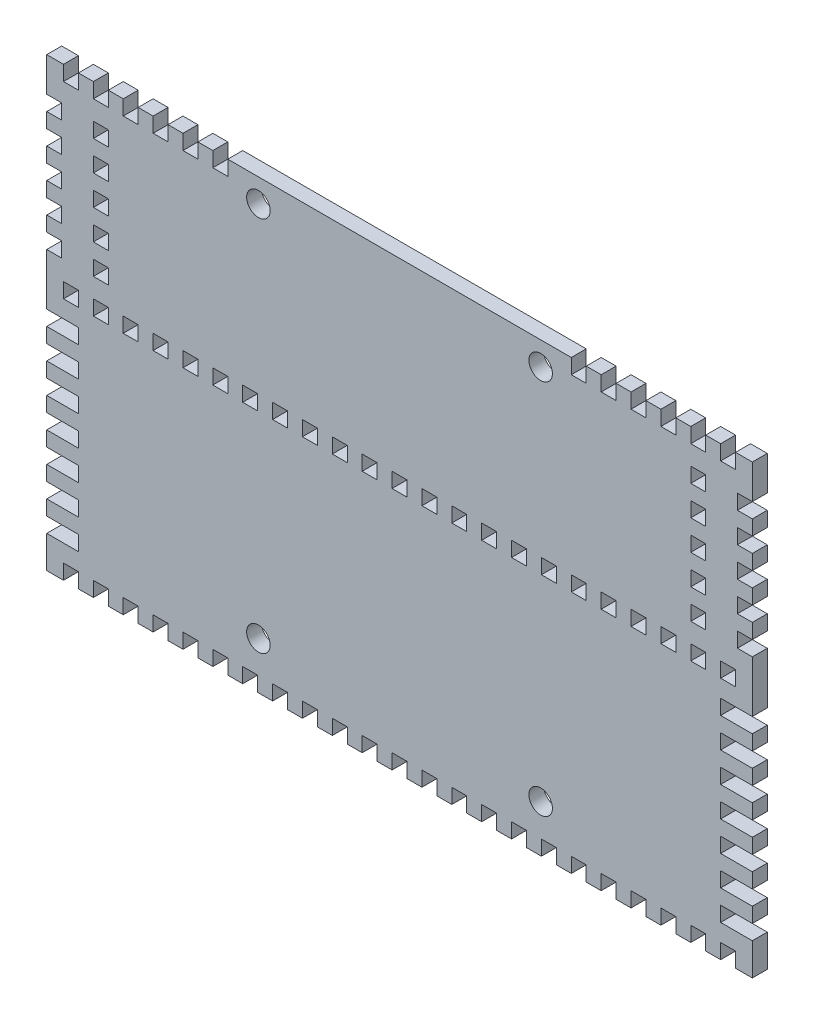
from build123d import *

# Parameters (mm, degrees)
SKETCH1_W                = 150
SKETCH1_H                = 55
BOSS_EXTRUDE1_DEPTH      = 3.175
CUT_EXTRUDE1_REACH       = 81.946
SKETCH2_W                = 3.175
SKETCH2_H                = 6.35
LPATTERN1_COUNT          = 12
LPATTERN1_PITCH          = 6.35
LPATTERN1_COL_COUNT      = 12
LPATTERN1_COL_PITCH      = 6.35
MIRROR1_COPY_1_REACH     = 81.946
MIRROR1_COPY_1_SKETCH_W  = 3.175
MIRROR1_COPY_1_SKETCH_H  = 6.35
MIRROR1_COPY_2_REACH     = 81.946
MIRROR1_COPY_2_SKETCH_W  = 3.175
MIRROR1_COPY_2_SKETCH_H  = 6.35
MIRROR1_COPY_3_REACH     = 81.946
MIRROR1_COPY_3_SKETCH_W  = 3.175
MIRROR1_COPY_3_SKETCH_H  = 6.35
MIRROR1_COPY_4_REACH     = 81.946
MIRROR1_COPY_4_SKETCH_W  = 3.175
MIRROR1_COPY_4_SKETCH_H  = 6.35
MIRROR1_COPY_5_REACH     = 81.946
MIRROR1_COPY_5_SKETCH_W  = 3.175
MIRROR1_COPY_5_SKETCH_H  = 6.35
MIRROR1_COPY_6_REACH     = 81.946
MIRROR1_COPY_6_SKETCH_W  = 3.175
MIRROR1_COPY_6_SKETCH_H  = 6.35
MIRROR1_COPY_7_REACH     = 81.946
MIRROR1_COPY_7_SKETCH_W  = 3.175
MIRROR1_COPY_7_SKETCH_H  = 6.35
MIRROR1_COPY_8_REACH     = 81.946
MIRROR1_COPY_8_SKETCH_W  = 3.175
MIRROR1_COPY_8_SKETCH_H  = 6.35
MIRROR1_COPY_9_REACH     = 81.946
MIRROR1_COPY_9_SKETCH_W  = 3.175
MIRROR1_COPY_9_SKETCH_H  = 6.35
MIRROR1_COPY_10_REACH    = 81.946
MIRROR1_COPY_10_SKETCH_W = 3.175
MIRROR1_COPY_10_SKETCH_H = 6.35
MIRROR1_COPY_11_REACH    = 81.946
MIRROR1_COPY_11_SKETCH_W = 3.175
MIRROR1_COPY_11_SKETCH_H = 6.35
MIRROR1_COPY_12_REACH    = 81.946
MIRROR1_COPY_12_SKETCH_W = 3.175
MIRROR1_COPY_12_SKETCH_H = 6.35
MIRROR1_COPY_13_REACH    = 81.946
MIRROR1_COPY_13_SKETCH_W = 3.175
MIRROR1_COPY_13_SKETCH_H = 6.35
MIRROR1_COPY_14_REACH    = 81.946
MIRROR1_COPY_14_SKETCH_W = 3.175
MIRROR1_COPY_14_SKETCH_H = 6.35
MIRROR1_COPY_15_REACH    = 81.946
MIRROR1_COPY_15_SKETCH_W = 3.175
MIRROR1_COPY_15_SKETCH_H = 6.35
MIRROR1_COPY_16_REACH    = 81.946
MIRROR1_COPY_16_SKETCH_W = 3.175
MIRROR1_COPY_16_SKETCH_H = 6.35
MIRROR1_COPY_17_REACH    = 81.946
MIRROR1_COPY_17_SKETCH_W = 3.175
MIRROR1_COPY_17_SKETCH_H = 6.35
MIRROR1_COPY_18_REACH    = 81.946
MIRROR1_COPY_18_SKETCH_W = 3.175
MIRROR1_COPY_18_SKETCH_H = 6.35
MIRROR1_COPY_19_REACH    = 81.946
MIRROR1_COPY_19_SKETCH_W = 3.175
MIRROR1_COPY_19_SKETCH_H = 6.35
MIRROR1_COPY_20_REACH    = 81.946
MIRROR1_COPY_20_SKETCH_W = 3.175
MIRROR1_COPY_20_SKETCH_H = 6.35
MIRROR1_COPY_21_REACH    = 81.946
MIRROR1_COPY_21_SKETCH_W = 3.175
MIRROR1_COPY_21_SKETCH_H = 6.35
MIRROR1_COPY_22_REACH    = 81.946
MIRROR1_COPY_22_SKETCH_W = 3.175
MIRROR1_COPY_22_SKETCH_H = 6.35
SKETCH3_W                = 6.35
SKETCH3_H                = 3.175
CUT_EXTRUDE2_DEPTH       = 10
LPATTERN2_COUNT          = 4
LPATTERN2_PITCH          = 6.35
LPATTERN2_COL_COUNT      = 4
LPATTERN2_COL_PITCH      = 6.35
MIRROR2_COPY_1_SKETCH_W  = 6.35
MIRROR2_COPY_1_SKETCH_H  = 3.175
MIRROR2_COPY_1_DEPTH     = 10
MIRROR2_COPY_2_SKETCH_W  = 6.35
MIRROR2_COPY_2_SKETCH_H  = 3.175
MIRROR2_COPY_2_DEPTH     = 10
MIRROR2_COPY_3_SKETCH_W  = 6.35
MIRROR2_COPY_3_SKETCH_H  = 3.175
MIRROR2_COPY_3_DEPTH     = 10
MIRROR2_COPY_4_SKETCH_W  = 6.35
MIRROR2_COPY_4_SKETCH_H  = 3.175
MIRROR2_COPY_4_DEPTH     = 10
MIRROR2_COPY_5_SKETCH_W  = 6.35
MIRROR2_COPY_5_SKETCH_H  = 3.175
MIRROR2_COPY_5_DEPTH     = 10
MIRROR2_COPY_6_SKETCH_W  = 6.35
MIRROR2_COPY_6_SKETCH_H  = 3.175
MIRROR2_COPY_6_DEPTH     = 10
SKETCH5_W                = 150
SKETCH5_H                = 40
BOSS_EXTRUDE2_DEPTH      = 3.175
CUT_EXTRUDE5_DEPTH       = 10
LPATTERN3_COUNT          = 12
LPATTERN3_PITCH          = 6.35
LPATTERN3_COL_COUNT      = 12
LPATTERN3_COL_PITCH      = 6.35
SKETCH8_W                = 3.5625
SKETCH8_H                = 3.175
CUT_EXTRUDE6_DEPTH       = 10
LPATTERN4_COUNT          = 7
LPATTERN4_PITCH          = 6.35
MIRROR3_COPY_1_SKETCH_W  = 3.5625
MIRROR3_COPY_1_SKETCH_H  = 3.175
MIRROR3_COPY_1_DEPTH     = 10
MIRROR3_COPY_2_SKETCH_W  = 3.5625
MIRROR3_COPY_2_SKETCH_H  = 3.175
MIRROR3_COPY_2_DEPTH     = 10
MIRROR3_COPY_3_SKETCH_W  = 3.5625
MIRROR3_COPY_3_SKETCH_H  = 3.175
MIRROR3_COPY_3_DEPTH     = 10
MIRROR3_COPY_4_SKETCH_W  = 3.5625
MIRROR3_COPY_4_SKETCH_H  = 3.175
MIRROR3_COPY_4_DEPTH     = 10
MIRROR3_COPY_5_SKETCH_W  = 3.5625
MIRROR3_COPY_5_SKETCH_H  = 3.175
MIRROR3_COPY_5_DEPTH     = 10
MIRROR3_COPY_6_SKETCH_W  = 3.5625
MIRROR3_COPY_6_SKETCH_H  = 3.175
MIRROR3_COPY_6_DEPTH     = 10
SKETCH11_W               = 73.025
SKETCH11_H               = 3.175
BOSS_EXTRUDE3_DEPTH      = 3.175
SKETCH10_R               = 2.5
CUT_EXTRUDE7_DEPTH       = 10
SKETCH12_W               = 6.35
SKETCH12_H               = 3.175
CUT_EXTRUDE8_DEPTH       = 10
LPATTERN5_COUNT          = 3
LPATTERN5_PITCH          = 6.35
LPATTERN5_COL_COUNT      = 3
LPATTERN5_COL_PITCH      = 6.35
MIRROR4_COPY_1_SKETCH_W  = 6.35
MIRROR4_COPY_1_SKETCH_H  = 3.175
MIRROR4_COPY_1_DEPTH     = 10
MIRROR4_COPY_2_SKETCH_W  = 6.35
MIRROR4_COPY_2_SKETCH_H  = 3.175
MIRROR4_COPY_2_DEPTH     = 10
MIRROR4_COPY_3_SKETCH_W  = 6.35
MIRROR4_COPY_3_SKETCH_H  = 3.175
MIRROR4_COPY_3_DEPTH     = 10
MIRROR4_COPY_4_SKETCH_W  = 6.35
MIRROR4_COPY_4_SKETCH_H  = 3.175
MIRROR4_COPY_4_DEPTH     = 10
SKETCH13_W               = 3.175
SKETCH13_H               = 3.175
CUT_EXTRUDE9_DEPTH       = 10
LPATTERN6_COUNT          = 3
LPATTERN6_PITCH          = 6.35
LPATTERN6_COL_COUNT      = 3
LPATTERN6_COL_PITCH      = 6.35
MIRROR5_COPY_1_SKETCH_W  = 3.175
MIRROR5_COPY_1_SKETCH_H  = 3.175
MIRROR5_COPY_1_DEPTH     = 10
MIRROR5_COPY_2_SKETCH_W  = 3.175
MIRROR5_COPY_2_SKETCH_H  = 3.175
MIRROR5_COPY_2_DEPTH     = 10
MIRROR5_COPY_3_SKETCH_W  = 3.175
MIRROR5_COPY_3_SKETCH_H  = 3.175
MIRROR5_COPY_3_DEPTH     = 10
MIRROR5_COPY_4_SKETCH_W  = 3.175
MIRROR5_COPY_4_SKETCH_H  = 3.175
MIRROR5_COPY_4_DEPTH     = 10


with BuildPart() as part:
    # Sketch1 → Boss-Extrude1 (new body)
    with BuildSketch(Plane.XY):
        Rectangle(SKETCH1_W, SKETCH1_H)
    extrude(amount=BOSS_EXTRUDE1_DEPTH)

    # Sketch2 → Cut-Extrude1 (cut, up to next)
    with BuildSketch(Plane(origin=(0, 0, 0), x_dir=(-1, 0, 0), z_dir=(0, 0, -1)), mode=Mode.PRIVATE) as cut_extrude1_sk1:
        with Locations((0, 27.5)):
            Rectangle(SKETCH2_W, SKETCH2_H)
    cut_extrude1_tool1 = extrude(cut_extrude1_sk1.sketch, amount=-CUT_EXTRUDE1_REACH, mode=Mode.PRIVATE) & part.part
    cut_extrude1 = cut_extrude1_tool1.solids().sort_by_distance((0, 27.5, 0))[0]
    add(cut_extrude1, mode=Mode.SUBTRACT)

    # LPattern1: Cut-Extrude1 ×12
    with Locations(*[(i * LPATTERN1_PITCH, 0, 0) for i in range(1, LPATTERN1_COUNT)]):
        add(cut_extrude1, mode=Mode.SUBTRACT)

    # LPattern1 col: Cut-Extrude1 ×12
    with Locations(*[(-i * LPATTERN1_COL_PITCH, 0, 0) for i in range(1, LPATTERN1_COL_COUNT)]):
        add(cut_extrude1, mode=Mode.SUBTRACT)

    # Mirror1: Cut-Extrude1 across plane
    add(cut_extrude1.mirror(Plane.ZX), mode=Mode.SUBTRACT)

    # Mirror1 copy 1 sketch → Mirror1 copy 1 (cut, up to next)
    with BuildSketch(Plane(origin=(6.35, 0, 0), x_dir=(-1, 0, 0), z_dir=(0, 0, -1)), mode=Mode.PRIVATE) as mirror1_copy_1_sk1:
        with Locations((0, -27.5)):
            Rectangle(MIRROR1_COPY_1_SKETCH_W, MIRROR1_COPY_1_SKETCH_H)
    mirror1_copy_1_tool1 = extrude(mirror1_copy_1_sk1.sketch, amount=-MIRROR1_COPY_1_REACH, mode=Mode.PRIVATE) & part.part
    add(mirror1_copy_1_tool1.solids().sort_by_distance((6.35, -27.5, 0))[0], mode=Mode.SUBTRACT)

    # Mirror1 copy 2 sketch → Mirror1 copy 2 (cut, up to next)
    with BuildSketch(Plane(origin=(12.7, 0, 0), x_dir=(-1, 0, 0), z_dir=(0, 0, -1)), mode=Mode.PRIVATE) as mirror1_copy_2_sk1:
        with Locations((0, -27.5)):
            Rectangle(MIRROR1_COPY_2_SKETCH_W, MIRROR1_COPY_2_SKETCH_H)
    mirror1_copy_2_tool1 = extrude(mirror1_copy_2_sk1.sketch, amount=-MIRROR1_COPY_2_REACH, mode=Mode.PRIVATE) & part.part
    add(mirror1_copy_2_tool1.solids().sort_by_distance((12.7, -27.5, 0))[0], mode=Mode.SUBTRACT)

    # Mirror1 copy 3 sketch → Mirror1 copy 3 (cut, up to next)
    with BuildSketch(Plane(origin=(19.05, 0, 0), x_dir=(-1, 0, 0), z_dir=(0, 0, -1)), mode=Mode.PRIVATE) as mirror1_copy_3_sk1:
        with Locations((0, -27.5)):
            Rectangle(MIRROR1_COPY_3_SKETCH_W, MIRROR1_COPY_3_SKETCH_H)
    mirror1_copy_3_tool1 = extrude(mirror1_copy_3_sk1.sketch, amount=-MIRROR1_COPY_3_REACH, mode=Mode.PRIVATE) & part.part
    add(mirror1_copy_3_tool1.solids().sort_by_distance((19.05, -27.5, 0))[0], mode=Mode.SUBTRACT)

    # Mirror1 copy 4 sketch → Mirror1 copy 4 (cut, up to next)
    with BuildSketch(Plane(origin=(25.4, 0, 0), x_dir=(-1, 0, 0), z_dir=(0, 0, -1)), mode=Mode.PRIVATE) as mirror1_copy_4_sk1:
        with Locations((0, -27.5)):
            Rectangle(MIRROR1_COPY_4_SKETCH_W, MIRROR1_COPY_4_SKETCH_H)
    mirror1_copy_4_tool1 = extrude(mirror1_copy_4_sk1.sketch, amount=-MIRROR1_COPY_4_REACH, mode=Mode.PRIVATE) & part.part
    add(mirror1_copy_4_tool1.solids().sort_by_distance((25.4, -27.5, 0))[0], mode=Mode.SUBTRACT)

    # Mirror1 copy 5 sketch → Mirror1 copy 5 (cut, up to next)
    with BuildSketch(Plane(origin=(31.75, 0, 0), x_dir=(-1, 0, 0), z_dir=(0, 0, -1)), mode=Mode.PRIVATE) as mirror1_copy_5_sk1:
        with Locations((0, -27.5)):
            Rectangle(MIRROR1_COPY_5_SKETCH_W, MIRROR1_COPY_5_SKETCH_H)
    mirror1_copy_5_tool1 = extrude(mirror1_copy_5_sk1.sketch, amount=-MIRROR1_COPY_5_REACH, mode=Mode.PRIVATE) & part.part
    add(mirror1_copy_5_tool1.solids().sort_by_distance((31.75, -27.5, 0))[0], mode=Mode.SUBTRACT)

    # Mirror1 copy 6 sketch → Mirror1 copy 6 (cut, up to next)
    with BuildSketch(Plane(origin=(38.1, 0, 0), x_dir=(-1, 0, 0), z_dir=(0, 0, -1)), mode=Mode.PRIVATE) as mirror1_copy_6_sk1:
        with Locations((0, -27.5)):
            Rectangle(MIRROR1_COPY_6_SKETCH_W, MIRROR1_COPY_6_SKETCH_H)
    mirror1_copy_6_tool1 = extrude(mirror1_copy_6_sk1.sketch, amount=-MIRROR1_COPY_6_REACH, mode=Mode.PRIVATE) & part.part
    add(mirror1_copy_6_tool1.solids().sort_by_distance((38.1, -27.5, 0))[0], mode=Mode.SUBTRACT)

    # Mirror1 copy 7 sketch → Mirror1 copy 7 (cut, up to next)
    with BuildSketch(Plane(origin=(44.45, 0, 0), x_dir=(-1, 0, 0), z_dir=(0, 0, -1)), mode=Mode.PRIVATE) as mirror1_copy_7_sk1:
        with Locations((0, -27.5)):
            Rectangle(MIRROR1_COPY_7_SKETCH_W, MIRROR1_COPY_7_SKETCH_H)
    mirror1_copy_7_tool1 = extrude(mirror1_copy_7_sk1.sketch, amount=-MIRROR1_COPY_7_REACH, mode=Mode.PRIVATE) & part.part
    add(mirror1_copy_7_tool1.solids().sort_by_distance((44.45, -27.5, 0))[0], mode=Mode.SUBTRACT)

    # Mirror1 copy 8 sketch → Mirror1 copy 8 (cut, up to next)
    with BuildSketch(Plane(origin=(50.8, 0, 0), x_dir=(-1, 0, 0), z_dir=(0, 0, -1)), mode=Mode.PRIVATE) as mirror1_copy_8_sk1:
        with Locations((0, -27.5)):
            Rectangle(MIRROR1_COPY_8_SKETCH_W, MIRROR1_COPY_8_SKETCH_H)
    mirror1_copy_8_tool1 = extrude(mirror1_copy_8_sk1.sketch, amount=-MIRROR1_COPY_8_REACH, mode=Mode.PRIVATE) & part.part
    add(mirror1_copy_8_tool1.solids().sort_by_distance((50.8, -27.5, 0))[0], mode=Mode.SUBTRACT)

    # Mirror1 copy 9 sketch → Mirror1 copy 9 (cut, up to next)
    with BuildSketch(Plane(origin=(57.15, 0, 0), x_dir=(-1, 0, 0), z_dir=(0, 0, -1)), mode=Mode.PRIVATE) as mirror1_copy_9_sk1:
        with Locations((0, -27.5)):
            Rectangle(MIRROR1_COPY_9_SKETCH_W, MIRROR1_COPY_9_SKETCH_H)
    mirror1_copy_9_tool1 = extrude(mirror1_copy_9_sk1.sketch, amount=-MIRROR1_COPY_9_REACH, mode=Mode.PRIVATE) & part.part
    add(mirror1_copy_9_tool1.solids().sort_by_distance((57.15, -27.5, 0))[0], mode=Mode.SUBTRACT)

    # Mirror1 copy 10 sketch → Mirror1 copy 10 (cut, up to next)
    with BuildSketch(Plane(origin=(63.5, 0, 0), x_dir=(-1, 0, 0), z_dir=(0, 0, -1)), mode=Mode.PRIVATE) as mirror1_copy_10_sk1:
        with Locations((0, -27.5)):
            Rectangle(MIRROR1_COPY_10_SKETCH_W, MIRROR1_COPY_10_SKETCH_H)
    mirror1_copy_10_tool1 = extrude(mirror1_copy_10_sk1.sketch, amount=-MIRROR1_COPY_10_REACH, mode=Mode.PRIVATE) & part.part
    add(mirror1_copy_10_tool1.solids().sort_by_distance((63.5, -27.5, 0))[0], mode=Mode.SUBTRACT)

    # Mirror1 copy 11 sketch → Mirror1 copy 11 (cut, up to next)
    with BuildSketch(Plane(origin=(69.85, 0, 0), x_dir=(-1, 0, 0), z_dir=(0, 0, -1)), mode=Mode.PRIVATE) as mirror1_copy_11_sk1:
        with Locations((0, -27.5)):
            Rectangle(MIRROR1_COPY_11_SKETCH_W, MIRROR1_COPY_11_SKETCH_H)
    mirror1_copy_11_tool1 = extrude(mirror1_copy_11_sk1.sketch, amount=-MIRROR1_COPY_11_REACH, mode=Mode.PRIVATE) & part.part
    add(mirror1_copy_11_tool1.solids().sort_by_distance((69.85, -27.5, 0))[0], mode=Mode.SUBTRACT)

    # Mirror1 copy 12 sketch → Mirror1 copy 12 (cut, up to next)
    with BuildSketch(Plane(origin=(-6.35, 0, 0), x_dir=(-1, 0, 0), z_dir=(0, 0, -1)), mode=Mode.PRIVATE) as mirror1_copy_12_sk1:
        with Locations((0, -27.5)):
            Rectangle(MIRROR1_COPY_12_SKETCH_W, MIRROR1_COPY_12_SKETCH_H)
    mirror1_copy_12_tool1 = extrude(mirror1_copy_12_sk1.sketch, amount=-MIRROR1_COPY_12_REACH, mode=Mode.PRIVATE) & part.part
    add(mirror1_copy_12_tool1.solids().sort_by_distance((-6.35, -27.5, 0))[0], mode=Mode.SUBTRACT)

    # Mirror1 copy 13 sketch → Mirror1 copy 13 (cut, up to next)
    with BuildSketch(Plane(origin=(-12.7, 0, 0), x_dir=(-1, 0, 0), z_dir=(0, 0, -1)), mode=Mode.PRIVATE) as mirror1_copy_13_sk1:
        with Locations((0, -27.5)):
            Rectangle(MIRROR1_COPY_13_SKETCH_W, MIRROR1_COPY_13_SKETCH_H)
    mirror1_copy_13_tool1 = extrude(mirror1_copy_13_sk1.sketch, amount=-MIRROR1_COPY_13_REACH, mode=Mode.PRIVATE) & part.part
    add(mirror1_copy_13_tool1.solids().sort_by_distance((-12.7, -27.5, 0))[0], mode=Mode.SUBTRACT)

    # Mirror1 copy 14 sketch → Mirror1 copy 14 (cut, up to next)
    with BuildSketch(Plane(origin=(-19.05, 0, 0), x_dir=(-1, 0, 0), z_dir=(0, 0, -1)), mode=Mode.PRIVATE) as mirror1_copy_14_sk1:
        with Locations((0, -27.5)):
            Rectangle(MIRROR1_COPY_14_SKETCH_W, MIRROR1_COPY_14_SKETCH_H)
    mirror1_copy_14_tool1 = extrude(mirror1_copy_14_sk1.sketch, amount=-MIRROR1_COPY_14_REACH, mode=Mode.PRIVATE) & part.part
    add(mirror1_copy_14_tool1.solids().sort_by_distance((-19.05, -27.5, 0))[0], mode=Mode.SUBTRACT)

    # Mirror1 copy 15 sketch → Mirror1 copy 15 (cut, up to next)
    with BuildSketch(Plane(origin=(-25.4, 0, 0), x_dir=(-1, 0, 0), z_dir=(0, 0, -1)), mode=Mode.PRIVATE) as mirror1_copy_15_sk1:
        with Locations((0, -27.5)):
            Rectangle(MIRROR1_COPY_15_SKETCH_W, MIRROR1_COPY_15_SKETCH_H)
    mirror1_copy_15_tool1 = extrude(mirror1_copy_15_sk1.sketch, amount=-MIRROR1_COPY_15_REACH, mode=Mode.PRIVATE) & part.part
    add(mirror1_copy_15_tool1.solids().sort_by_distance((-25.4, -27.5, 0))[0], mode=Mode.SUBTRACT)

    # Mirror1 copy 16 sketch → Mirror1 copy 16 (cut, up to next)
    with BuildSketch(Plane(origin=(-31.75, 0, 0), x_dir=(-1, 0, 0), z_dir=(0, 0, -1)), mode=Mode.PRIVATE) as mirror1_copy_16_sk1:
        with Locations((0, -27.5)):
            Rectangle(MIRROR1_COPY_16_SKETCH_W, MIRROR1_COPY_16_SKETCH_H)
    mirror1_copy_16_tool1 = extrude(mirror1_copy_16_sk1.sketch, amount=-MIRROR1_COPY_16_REACH, mode=Mode.PRIVATE) & part.part
    add(mirror1_copy_16_tool1.solids().sort_by_distance((-31.75, -27.5, 0))[0], mode=Mode.SUBTRACT)

    # Mirror1 copy 17 sketch → Mirror1 copy 17 (cut, up to next)
    with BuildSketch(Plane(origin=(-38.1, 0, 0), x_dir=(-1, 0, 0), z_dir=(0, 0, -1)), mode=Mode.PRIVATE) as mirror1_copy_17_sk1:
        with Locations((0, -27.5)):
            Rectangle(MIRROR1_COPY_17_SKETCH_W, MIRROR1_COPY_17_SKETCH_H)
    mirror1_copy_17_tool1 = extrude(mirror1_copy_17_sk1.sketch, amount=-MIRROR1_COPY_17_REACH, mode=Mode.PRIVATE) & part.part
    add(mirror1_copy_17_tool1.solids().sort_by_distance((-38.1, -27.5, 0))[0], mode=Mode.SUBTRACT)

    # Mirror1 copy 18 sketch → Mirror1 copy 18 (cut, up to next)
    with BuildSketch(Plane(origin=(-44.45, 0, 0), x_dir=(-1, 0, 0), z_dir=(0, 0, -1)), mode=Mode.PRIVATE) as mirror1_copy_18_sk1:
        with Locations((0, -27.5)):
            Rectangle(MIRROR1_COPY_18_SKETCH_W, MIRROR1_COPY_18_SKETCH_H)
    mirror1_copy_18_tool1 = extrude(mirror1_copy_18_sk1.sketch, amount=-MIRROR1_COPY_18_REACH, mode=Mode.PRIVATE) & part.part
    add(mirror1_copy_18_tool1.solids().sort_by_distance((-44.45, -27.5, 0))[0], mode=Mode.SUBTRACT)

    # Mirror1 copy 19 sketch → Mirror1 copy 19 (cut, up to next)
    with BuildSketch(Plane(origin=(-50.8, 0, 0), x_dir=(-1, 0, 0), z_dir=(0, 0, -1)), mode=Mode.PRIVATE) as mirror1_copy_19_sk1:
        with Locations((0, -27.5)):
            Rectangle(MIRROR1_COPY_19_SKETCH_W, MIRROR1_COPY_19_SKETCH_H)
    mirror1_copy_19_tool1 = extrude(mirror1_copy_19_sk1.sketch, amount=-MIRROR1_COPY_19_REACH, mode=Mode.PRIVATE) & part.part
    add(mirror1_copy_19_tool1.solids().sort_by_distance((-50.8, -27.5, 0))[0], mode=Mode.SUBTRACT)

    # Mirror1 copy 20 sketch → Mirror1 copy 20 (cut, up to next)
    with BuildSketch(Plane(origin=(-57.15, 0, 0), x_dir=(-1, 0, 0), z_dir=(0, 0, -1)), mode=Mode.PRIVATE) as mirror1_copy_20_sk1:
        with Locations((0, -27.5)):
            Rectangle(MIRROR1_COPY_20_SKETCH_W, MIRROR1_COPY_20_SKETCH_H)
    mirror1_copy_20_tool1 = extrude(mirror1_copy_20_sk1.sketch, amount=-MIRROR1_COPY_20_REACH, mode=Mode.PRIVATE) & part.part
    add(mirror1_copy_20_tool1.solids().sort_by_distance((-57.15, -27.5, 0))[0], mode=Mode.SUBTRACT)

    # Mirror1 copy 21 sketch → Mirror1 copy 21 (cut, up to next)
    with BuildSketch(Plane(origin=(-63.5, 0, 0), x_dir=(-1, 0, 0), z_dir=(0, 0, -1)), mode=Mode.PRIVATE) as mirror1_copy_21_sk1:
        with Locations((0, -27.5)):
            Rectangle(MIRROR1_COPY_21_SKETCH_W, MIRROR1_COPY_21_SKETCH_H)
    mirror1_copy_21_tool1 = extrude(mirror1_copy_21_sk1.sketch, amount=-MIRROR1_COPY_21_REACH, mode=Mode.PRIVATE) & part.part
    add(mirror1_copy_21_tool1.solids().sort_by_distance((-63.5, -27.5, 0))[0], mode=Mode.SUBTRACT)

    # Mirror1 copy 22 sketch → Mirror1 copy 22 (cut, up to next)
    with BuildSketch(Plane(origin=(-69.85, 0, 0), x_dir=(-1, 0, 0), z_dir=(0, 0, -1)), mode=Mode.PRIVATE) as mirror1_copy_22_sk1:
        with Locations((0, -27.5)):
            Rectangle(MIRROR1_COPY_22_SKETCH_W, MIRROR1_COPY_22_SKETCH_H)
    mirror1_copy_22_tool1 = extrude(mirror1_copy_22_sk1.sketch, amount=-MIRROR1_COPY_22_REACH, mode=Mode.PRIVATE) & part.part
    add(mirror1_copy_22_tool1.solids().sort_by_distance((-69.85, -27.5, 0))[0], mode=Mode.SUBTRACT)

    # Sketch3 → Cut-Extrude2 (cut)
    with BuildSketch(Plane(origin=(0, 0, 0), x_dir=(-1, 0, 0), z_dir=(0, 0, -1))):
        with Locations((-75, 0)):
            Rectangle(SKETCH3_W, SKETCH3_H)
    cut_extrude2 = extrude(amount=-CUT_EXTRUDE2_DEPTH, mode=Mode.SUBTRACT)

    # LPattern2: Cut-Extrude2 ×4
    with Locations(*[(0, i * LPATTERN2_PITCH, 0) for i in range(1, LPATTERN2_COUNT)]):
        add(cut_extrude2, mode=Mode.SUBTRACT)

    # LPattern2 col: Cut-Extrude2 ×4
    with Locations(*[(0, -i * LPATTERN2_COL_PITCH, 0) for i in range(1, LPATTERN2_COL_COUNT)]):
        add(cut_extrude2, mode=Mode.SUBTRACT)

    # Mirror2: Cut-Extrude2 across plane
    add(cut_extrude2.mirror(Plane(origin=(0, 0, 0), x_dir=(0, 0, 1), z_dir=(1, 0, 0))), mode=Mode.SUBTRACT)

    # Mirror2 copy 1 sketch → Mirror2 copy 1 (cut)
    with BuildSketch(Plane(origin=(0, 6.35, 0), x_dir=(1, 0, 0), z_dir=(0, 0, -1))):
        with Locations((-75, 0)):
            Rectangle(MIRROR2_COPY_1_SKETCH_W, MIRROR2_COPY_1_SKETCH_H)
    extrude(amount=-MIRROR2_COPY_1_DEPTH, mode=Mode.SUBTRACT)

    # Mirror2 copy 2 sketch → Mirror2 copy 2 (cut)
    with BuildSketch(Plane(origin=(0, 12.7, 0), x_dir=(1, 0, 0), z_dir=(0, 0, -1))):
        with Locations((-75, 0)):
            Rectangle(MIRROR2_COPY_2_SKETCH_W, MIRROR2_COPY_2_SKETCH_H)
    extrude(amount=-MIRROR2_COPY_2_DEPTH, mode=Mode.SUBTRACT)

    # Mirror2 copy 3 sketch → Mirror2 copy 3 (cut)
    with BuildSketch(Plane(origin=(0, 19.05, 0), x_dir=(1, 0, 0), z_dir=(0, 0, -1))):
        with Locations((-75, 0)):
            Rectangle(MIRROR2_COPY_3_SKETCH_W, MIRROR2_COPY_3_SKETCH_H)
    extrude(amount=-MIRROR2_COPY_3_DEPTH, mode=Mode.SUBTRACT)

    # Mirror2 copy 4 sketch → Mirror2 copy 4 (cut)
    with BuildSketch(Plane(origin=(0, -6.35, 0), x_dir=(1, 0, 0), z_dir=(0, 0, -1))):
        with Locations((-75, 0)):
            Rectangle(MIRROR2_COPY_4_SKETCH_W, MIRROR2_COPY_4_SKETCH_H)
    extrude(amount=-MIRROR2_COPY_4_DEPTH, mode=Mode.SUBTRACT)

    # Mirror2 copy 5 sketch → Mirror2 copy 5 (cut)
    with BuildSketch(Plane(origin=(0, -12.7, 0), x_dir=(1, 0, 0), z_dir=(0, 0, -1))):
        with Locations((-75, 0)):
            Rectangle(MIRROR2_COPY_5_SKETCH_W, MIRROR2_COPY_5_SKETCH_H)
    extrude(amount=-MIRROR2_COPY_5_DEPTH, mode=Mode.SUBTRACT)

    # Mirror2 copy 6 sketch → Mirror2 copy 6 (cut)
    with BuildSketch(Plane(origin=(0, -19.05, 0), x_dir=(1, 0, 0), z_dir=(0, 0, -1))):
        with Locations((-75, 0)):
            Rectangle(MIRROR2_COPY_6_SKETCH_W, MIRROR2_COPY_6_SKETCH_H)
    extrude(amount=-MIRROR2_COPY_6_DEPTH, mode=Mode.SUBTRACT)

    # Sketch5 → Boss-Extrude2 (add)
    with BuildSketch(Plane(origin=(0, 0, 0), x_dir=(-1, 0, 0), z_dir=(0, 0, -1))):
        with Locations((0, 47.5)):
            Rectangle(SKETCH5_W, SKETCH5_H)
    extrude(amount=-BOSS_EXTRUDE2_DEPTH)

    # Sketch7 → Cut-Extrude5 (cut)
    with BuildSketch(Plane(origin=(0, 0, 0), x_dir=(-1, 0, 0), z_dir=(0, 0, -1))):
        Polygon((0, 67.5), (1.5875, 67.5), (1.5875, 64.325), (0, 64.325), (-1.5875, 64.325), (-1.5875, 67.5), align=None)
    cut_extrude5 = extrude(amount=-CUT_EXTRUDE5_DEPTH, mode=Mode.SUBTRACT)

    # LPattern3: Cut-Extrude5 ×12
    with Locations(*[(i * LPATTERN3_PITCH, 0, 0) for i in range(1, LPATTERN3_COUNT)]):
        add(cut_extrude5, mode=Mode.SUBTRACT)

    # LPattern3 col: Cut-Extrude5 ×12
    with Locations(*[(-i * LPATTERN3_COL_PITCH, 0, 0) for i in range(1, LPATTERN3_COL_COUNT)]):
        add(cut_extrude5, mode=Mode.SUBTRACT)

    # Sketch8 → Cut-Extrude6 (cut)
    with BuildSketch(Plane(origin=(0, 0, 0), x_dir=(-1, 0, 0), z_dir=(0, 0, -1))):
        with Locations((-70.04375, 19.05)):
            Rectangle(SKETCH8_W, SKETCH8_H)
    cut_extrude6 = extrude(amount=-CUT_EXTRUDE6_DEPTH, mode=Mode.SUBTRACT)

    # LPattern4: Cut-Extrude6 ×7
    with Locations(*[(0, -i * LPATTERN4_PITCH, 0) for i in range(1, LPATTERN4_COUNT)]):
        add(cut_extrude6, mode=Mode.SUBTRACT)

    # Mirror3: Cut-Extrude6 across plane
    add(cut_extrude6.mirror(Plane(origin=(0, 0, 0), x_dir=(0, 0, 1), z_dir=(1, 0, 0))), mode=Mode.SUBTRACT)

    # Mirror3 copy 1 sketch → Mirror3 copy 1 (cut)
    with BuildSketch(Plane(origin=(0, -6.35, 0), x_dir=(1, 0, 0), z_dir=(0, 0, -1))):
        with Locations((-70.04375, -19.05)):
            Rectangle(MIRROR3_COPY_1_SKETCH_W, MIRROR3_COPY_1_SKETCH_H)
    extrude(amount=-MIRROR3_COPY_1_DEPTH, mode=Mode.SUBTRACT)

    # Mirror3 copy 2 sketch → Mirror3 copy 2 (cut)
    with BuildSketch(Plane(origin=(0, -12.7, 0), x_dir=(1, 0, 0), z_dir=(0, 0, -1))):
        with Locations((-70.04375, -19.05)):
            Rectangle(MIRROR3_COPY_2_SKETCH_W, MIRROR3_COPY_2_SKETCH_H)
    extrude(amount=-MIRROR3_COPY_2_DEPTH, mode=Mode.SUBTRACT)

    # Mirror3 copy 3 sketch → Mirror3 copy 3 (cut)
    with BuildSketch(Plane(origin=(0, -19.05, 0), x_dir=(1, 0, 0), z_dir=(0, 0, -1))):
        with Locations((-70.04375, -19.05)):
            Rectangle(MIRROR3_COPY_3_SKETCH_W, MIRROR3_COPY_3_SKETCH_H)
    extrude(amount=-MIRROR3_COPY_3_DEPTH, mode=Mode.SUBTRACT)

    # Mirror3 copy 4 sketch → Mirror3 copy 4 (cut)
    with BuildSketch(Plane(origin=(0, -25.4, 0), x_dir=(1, 0, 0), z_dir=(0, 0, -1))):
        with Locations((-70.04375, -19.05)):
            Rectangle(MIRROR3_COPY_4_SKETCH_W, MIRROR3_COPY_4_SKETCH_H)
    extrude(amount=-MIRROR3_COPY_4_DEPTH, mode=Mode.SUBTRACT)

    # Mirror3 copy 5 sketch → Mirror3 copy 5 (cut)
    with BuildSketch(Plane(origin=(0, -31.75, 0), x_dir=(1, 0, 0), z_dir=(0, 0, -1))):
        with Locations((-70.04375, -19.05)):
            Rectangle(MIRROR3_COPY_5_SKETCH_W, MIRROR3_COPY_5_SKETCH_H)
    extrude(amount=-MIRROR3_COPY_5_DEPTH, mode=Mode.SUBTRACT)

    # Mirror3 copy 6 sketch → Mirror3 copy 6 (cut)
    with BuildSketch(Plane(origin=(0, -38.1, 0), x_dir=(1, 0, 0), z_dir=(0, 0, -1))):
        with Locations((-70.04375, -19.05)):
            Rectangle(MIRROR3_COPY_6_SKETCH_W, MIRROR3_COPY_6_SKETCH_H)
    extrude(amount=-MIRROR3_COPY_6_DEPTH, mode=Mode.SUBTRACT)

    # Sketch11 → Boss-Extrude3 (add)
    with BuildSketch(Plane(origin=(0, 0, 0), x_dir=(-1, 0, 0), z_dir=(0, 0, -1))):
        with Locations((0, 65.9125)):
            Rectangle(SKETCH11_W, SKETCH11_H)
    extrude(amount=-BOSS_EXTRUDE3_DEPTH)

    # Sketch10 → Cut-Extrude7 (cut)
    with BuildSketch(Plane(origin=(0, 0, 0), x_dir=(-1, 0, 0), z_dir=(0, 0, -1))):
        with Locations((-30, 62.5)):
            Circle(SKETCH10_R)
        with Locations((30, 62.5)):
            Circle(SKETCH10_R)
        with Locations((30, -17.5)):
            Circle(SKETCH10_R)
        with Locations((-30, -17.5)):
            Circle(SKETCH10_R)
    extrude(amount=-CUT_EXTRUDE7_DEPTH, mode=Mode.SUBTRACT)

    # Sketch12 → Cut-Extrude8 (cut)
    with BuildSketch(Plane(origin=(0, 0, 0), x_dir=(-1, 0, 0), z_dir=(0, 0, -1))):
        with Locations((-75, 45.9125)):
            Rectangle(SKETCH12_W, SKETCH12_H)
    cut_extrude8 = extrude(amount=-CUT_EXTRUDE8_DEPTH, mode=Mode.SUBTRACT)

    # LPattern5: Cut-Extrude8 ×3
    with Locations(*[(0, i * LPATTERN5_PITCH, 0) for i in range(1, LPATTERN5_COUNT)]):
        add(cut_extrude8, mode=Mode.SUBTRACT)

    # LPattern5 col: Cut-Extrude8 ×3
    with Locations(*[(0, -i * LPATTERN5_COL_PITCH, 0) for i in range(1, LPATTERN5_COL_COUNT)]):
        add(cut_extrude8, mode=Mode.SUBTRACT)

    # Mirror4: Cut-Extrude8 across plane
    add(cut_extrude8.mirror(Plane(origin=(0, 0, 0), x_dir=(0, 0, 1), z_dir=(1, 0, 0))), mode=Mode.SUBTRACT)

    # Mirror4 copy 1 sketch → Mirror4 copy 1 (cut)
    with BuildSketch(Plane(origin=(0, 6.35, 0), x_dir=(1, 0, 0), z_dir=(0, 0, -1))):
        with Locations((-75, -45.9125)):
            Rectangle(MIRROR4_COPY_1_SKETCH_W, MIRROR4_COPY_1_SKETCH_H)
    extrude(amount=-MIRROR4_COPY_1_DEPTH, mode=Mode.SUBTRACT)

    # Mirror4 copy 2 sketch → Mirror4 copy 2 (cut)
    with BuildSketch(Plane(origin=(0, 12.7, 0), x_dir=(1, 0, 0), z_dir=(0, 0, -1))):
        with Locations((-75, -45.9125)):
            Rectangle(MIRROR4_COPY_2_SKETCH_W, MIRROR4_COPY_2_SKETCH_H)
    extrude(amount=-MIRROR4_COPY_2_DEPTH, mode=Mode.SUBTRACT)

    # Mirror4 copy 3 sketch → Mirror4 copy 3 (cut)
    with BuildSketch(Plane(origin=(0, -6.35, 0), x_dir=(1, 0, 0), z_dir=(0, 0, -1))):
        with Locations((-75, -45.9125)):
            Rectangle(MIRROR4_COPY_3_SKETCH_W, MIRROR4_COPY_3_SKETCH_H)
    extrude(amount=-MIRROR4_COPY_3_DEPTH, mode=Mode.SUBTRACT)

    # Mirror4 copy 4 sketch → Mirror4 copy 4 (cut)
    with BuildSketch(Plane(origin=(0, -12.7, 0), x_dir=(1, 0, 0), z_dir=(0, 0, -1))):
        with Locations((-75, -45.9125)):
            Rectangle(MIRROR4_COPY_4_SKETCH_W, MIRROR4_COPY_4_SKETCH_H)
    extrude(amount=-MIRROR4_COPY_4_DEPTH, mode=Mode.SUBTRACT)

    # Sketch13 → Cut-Extrude9 (cut)
    with BuildSketch(Plane(origin=(0, 0, 0), x_dir=(-1, 0, 0), z_dir=(0, 0, -1))):
        with Locations((-63.5, 45.9125)):
            Rectangle(SKETCH13_W, SKETCH13_H)
    cut_extrude9 = extrude(amount=-CUT_EXTRUDE9_DEPTH, mode=Mode.SUBTRACT)

    # LPattern6: Cut-Extrude9 ×3
    with Locations(*[(0, i * LPATTERN6_PITCH, 0) for i in range(1, LPATTERN6_COUNT)]):
        add(cut_extrude9, mode=Mode.SUBTRACT)

    # LPattern6 col: Cut-Extrude9 ×3
    with Locations(*[(0, -i * LPATTERN6_COL_PITCH, 0) for i in range(1, LPATTERN6_COL_COUNT)]):
        add(cut_extrude9, mode=Mode.SUBTRACT)

    # Mirror5: Cut-Extrude9 across plane
    add(cut_extrude9.mirror(Plane(origin=(0, 0, 0), x_dir=(0, 0, 1), z_dir=(1, 0, 0))), mode=Mode.SUBTRACT)

    # Mirror5 copy 1 sketch → Mirror5 copy 1 (cut)
    with BuildSketch(Plane(origin=(0, 6.35, 0), x_dir=(1, 0, 0), z_dir=(0, 0, -1))):
        with Locations((-63.5, -45.9125)):
            Rectangle(MIRROR5_COPY_1_SKETCH_W, MIRROR5_COPY_1_SKETCH_H)
    extrude(amount=-MIRROR5_COPY_1_DEPTH, mode=Mode.SUBTRACT)

    # Mirror5 copy 2 sketch → Mirror5 copy 2 (cut)
    with BuildSketch(Plane(origin=(0, 12.7, 0), x_dir=(1, 0, 0), z_dir=(0, 0, -1))):
        with Locations((-63.5, -45.9125)):
            Rectangle(MIRROR5_COPY_2_SKETCH_W, MIRROR5_COPY_2_SKETCH_H)
    extrude(amount=-MIRROR5_COPY_2_DEPTH, mode=Mode.SUBTRACT)

    # Mirror5 copy 3 sketch → Mirror5 copy 3 (cut)
    with BuildSketch(Plane(origin=(0, -6.35, 0), x_dir=(1, 0, 0), z_dir=(0, 0, -1))):
        with Locations((-63.5, -45.9125)):
            Rectangle(MIRROR5_COPY_3_SKETCH_W, MIRROR5_COPY_3_SKETCH_H)
    extrude(amount=-MIRROR5_COPY_3_DEPTH, mode=Mode.SUBTRACT)

    # Mirror5 copy 4 sketch → Mirror5 copy 4 (cut)
    with BuildSketch(Plane(origin=(0, -12.7, 0), x_dir=(1, 0, 0), z_dir=(0, 0, -1))):
        with Locations((-63.5, -45.9125)):
            Rectangle(MIRROR5_COPY_4_SKETCH_W, MIRROR5_COPY_4_SKETCH_H)
    extrude(amount=-MIRROR5_COPY_4_DEPTH, mode=Mode.SUBTRACT)


solid = part.part
